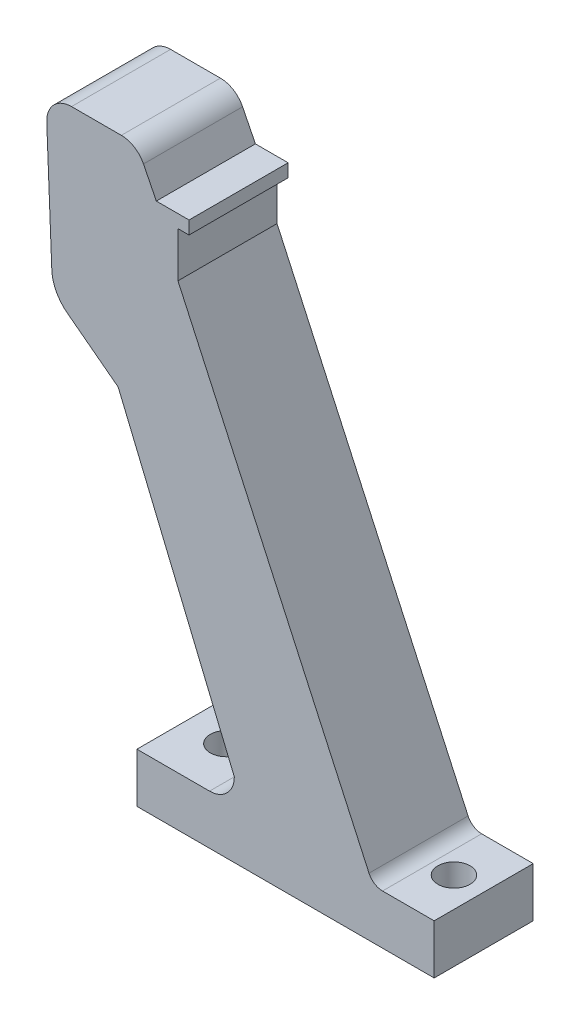
from build123d import *

# Parameters (mm, degrees)
BOSS_EXTRUDE1_DEPTH     = 20
CUT_EXTRUDE1_DEPTH      = 20
CUT_EXTRUDE1_DEPTH_BACK = 20
SKETCH3_R               = 3.25


with BuildPart() as part:
    # Sketch1 → Boss-Extrude1 (new body)
    with BuildSketch(Plane.XY):
        with BuildLine():
            Line((-44.097792079, -34.850100287), (-44.097792079, -44.850100287))
            Line((-44.097792079, -44.850100287), (15.902191644, -44.850100287))
            Line((15.902191644, -44.850100287), (15.902191644, -34.850100287))
            Line((15.902191644, -34.850100287), (5.481837679, -34.850100287))
            ThreePointArc((5.481837679, -34.850100287), (3.860980617, -34.374545252), (2.753994712, -33.098648543))
            Line((2.753994712, -33.098648543), (-35.815277858, 51.167953451))
            Line((-35.815277858, 51.167953451), (-35.815277858, 60.291959238))
            Line((-35.815277858, 60.291959238), (-33.576612404, 60.291959238))
            Line((-33.576612404, 60.291959238), (-33.576612404, 62.924734339))
            Line((-33.576612404, 62.924734339), (-40.180850679, 62.924734339))
            Line((-40.180850679, 62.924734339), (-42.770369484, 68.117950349))
            ThreePointArc((-42.770369484, 68.117950349), (-44.613967183, 70.138587546), (-47.244946047, 70.886770262))
            Line((-47.244946047, 70.886770262), (-57.300660313, 70.886770262))
            ThreePointArc((-57.300660313, 70.886770262), (-60.906449606, 69.350624123), (-62.296631179, 65.686083691))
            Line((-62.296631179, 65.686083691), (-61.293211228, 40.706550479))
            ThreePointArc((-61.293211228, 40.706550479), (-60.463803823, 37.168602153), (-58.148414135, 34.367894102))
            Line((-58.148414135, 34.367894102), (-47.87808719, 26.565161379))
            Line((-47.87808719, 26.565161379), (-24.43830161, -29.850100287))
            ThreePointArc((-24.43830161, -29.850100287), (-25.902767704, -33.385634193), (-29.43830161, -34.850100287))
            Line((-29.43830161, -34.850100287), (-35.915534593, -34.850100287))
            Line((-35.915534593, -34.850100287), (-44.097792079, -34.850100287))
        make_face()
    extrude(amount=BOSS_EXTRUDE1_DEPTH)

    # Sketch3 → Cut-Extrude1 (cut, two sides: drawn at the far end of the back side and taken through both)
    with BuildSketch(Plane(origin=(0, -34.850100287, 0), x_dir=(1, 0, 0), z_dir=(0, 1, 0)).offset(-CUT_EXTRUDE1_DEPTH_BACK)):
        with Locations((9.902191644, -10)):
            Circle(SKETCH3_R)
        with Locations((-36.038433316, -10)):
            Circle(SKETCH3_R)
    extrude(amount=CUT_EXTRUDE1_DEPTH + CUT_EXTRUDE1_DEPTH_BACK, mode=Mode.SUBTRACT)


solid = part.part
